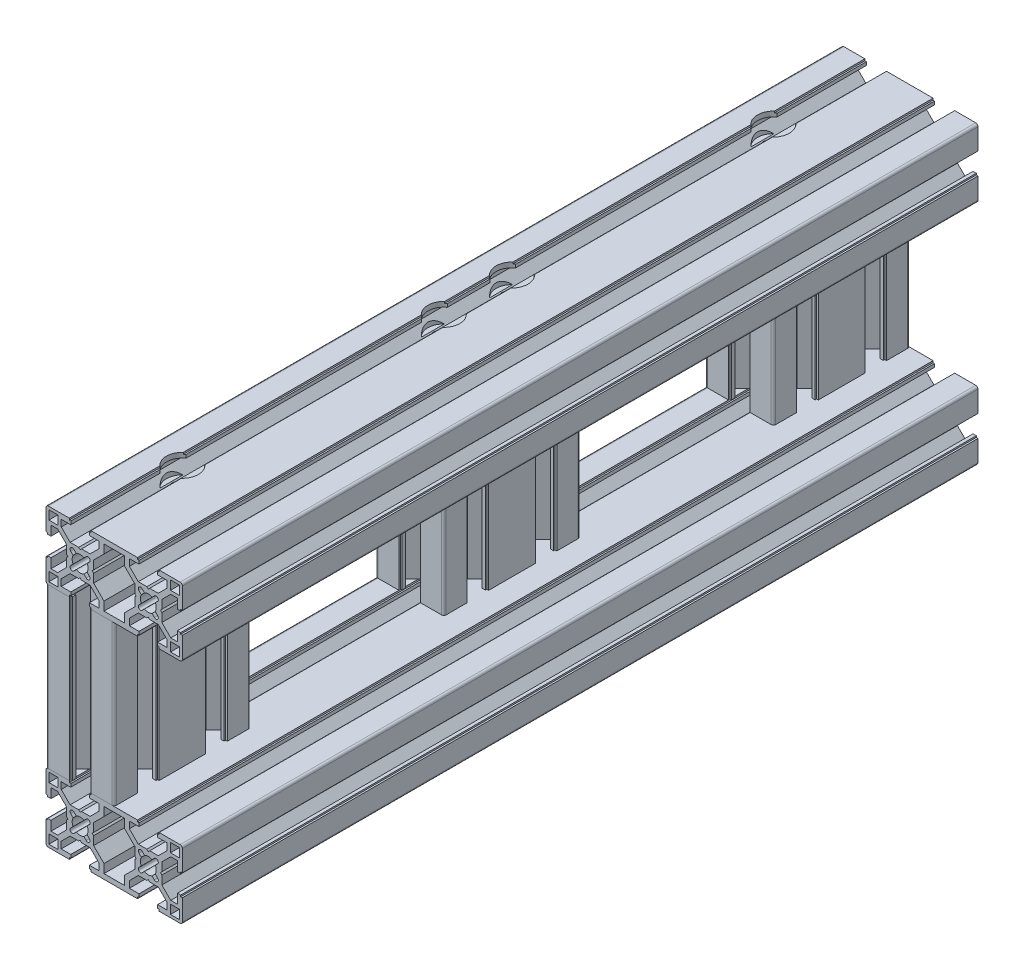
from build123d import *

# Parameters (mm, degrees)
T_SLOT_CNCCAT_3060_1_OUTLINE_W               = 3.960773678
T_SLOT_CNCCAT_3060_1_OUTLINE_H               = 3.960773678
T_SLOT_CNCCAT_3060_1_DEPTH                   = 350
T_SLOT_START                                 = -35
T_SLOT_CNCCAT_3060_1_2_OUTLINE_W             = 3.960773678
T_SLOT_CNCCAT_3060_1_2_OUTLINE_H             = 3.960773678
T_SLOT_CNCCAT_3060_1_2_DEPTH                 = 70
T_SLOT_CNCCAT_3060_1_3_OUTLINE_W             = 3.960773678
T_SLOT_CNCCAT_3060_1_3_OUTLINE_H             = 3.960773678
T_SLOT_CNCCAT_3060_1_3_DEPTH                 = 70
T_SLOT_CNCCAT_3060_1_4_OUTLINE_W             = 3.960773678
T_SLOT_CNCCAT_3060_1_4_OUTLINE_H             = 3.960773678
T_SLOT_CNCCAT_3060_1_4_DEPTH                 = 70
T_SLOT_CNCCAT_3060_1_5_OUTLINE_W             = 3.960773678
T_SLOT_CNCCAT_3060_1_5_OUTLINE_H             = 3.960773678
T_SLOT_CNCCAT_3060_1_5_DEPTH                 = 350
CBORE_FOR_M8_HEX_SOCKET_HEAD_CAP_SCR_2_COUNT = 2
CBORE_FOR_M8_HEX_SOCKET_HEAD_CAP_SCR_2_PITCH = 115
CBORE_FOR_M8_HEX_SOCKET_HEAD_CAP_SCR_3_COUNT = 2
CBORE_FOR_M8_HEX_SOCKET_HEAD_CAP_SCR_3_PITCH = 145
CBORE_FOR_M8_HEX_SOCKET_HEAD_CAP_SCR_4_COUNT = 2
CBORE_FOR_M8_HEX_SOCKET_HEAD_CAP_SCR_4_PITCH = 260
CBORE_FOR_M8_HEX_SOCKET_HEAD_CAP_SCR_5_COUNT = 2
CBORE_FOR_M8_HEX_SOCKET_HEAD_CAP_SCR_5_PITCH = 115
CBORE_FOR_M8_HEX_SOCKET_HEAD_CAP_SCR_6_COUNT = 2
CBORE_FOR_M8_HEX_SOCKET_HEAD_CAP_SCR_6_PITCH = 145
CBORE_FOR_M8_HEX_SOCKET_HEAD_CAP_SCR_7_COUNT = 2
CBORE_FOR_M8_HEX_SOCKET_HEAD_CAP_SCR_7_PITCH = 260


with BuildPart() as part:
    # T-slot CNCCAT-3060(1): read off the stored shape, not the designer's step
    # T-slot CNCCAT-3060(1) outline → T-slot CNCCAT-3060(1) (new body)
    with BuildSketch(Plane.XY):
        with BuildLine():
            Line((-20.956716316, -49.380405557), (-20.337121873, -50))
            Line((-20.337121873, -50), (-20.956716316, -50.619594443))
            Line((-20.956716316, -50.619594443), (-20.956716316, -54.401081398))
            Line((-20.956716316, -54.401081398), (-24.863654578, -58.30801966))
            Line((-24.863654578, -58.30801966), (-27.8, -58.30801966))
            Line((-27.8, -58.30801966), (-27.8, -54.1))
            Line((-27.8, -54.1), (-29.233870922, -54.1))
            Line((-29.233870922, -54.1), (-29.233870922, -54.756280561))
            Line((-29.233870922, -54.756280561), (-30, -54.756280561))
            Line((-30, -54.756280561), (-30, -64))
            ThreePointArc((-30, -64), (-29.707106781, -64.707106781), (-29, -65))
            Line((-29, -65), (-19.756280561, -65))
            Line((-19.756280561, -65), (-19.756280561, -64.233870922))
            Line((-19.756280561, -64.233870922), (-19.1, -64.233870922))
            Line((-19.1, -64.233870922), (-19.1, -62.8))
            Line((-19.1, -62.8), (-23.30801966, -62.8))
            Line((-23.30801966, -62.8), (-23.30801966, -59.863654578))
            Line((-23.30801966, -59.863654578), (-19.401081398, -55.956716316))
            Line((-19.401081398, -55.956716316), (-15.619594443, -55.956716316))
            Line((-15.619594443, -55.956716316), (-15, -55.337121873))
            Line((-15, -55.337121873), (-14.380405557, -55.956716316))
            Line((-14.380405557, -55.956716316), (-10.598918602, -55.956716316))
            Line((-10.598918602, -55.956716316), (-6.69198034, -59.863654578))
            Line((-6.69198034, -59.863654578), (-6.69198034, -62.8))
            Line((-6.69198034, -62.8), (-10.9, -62.8))
            Line((-10.9, -62.8), (-10.9, -64.233870922))
            Line((-10.9, -64.233870922), (-10.243719439, -64.233870922))
            Line((-10.243719439, -64.233870922), (-10.243719439, -65))
            Line((-10.243719439, -65), (10.243719439, -65))
            Line((10.243719439, -65), (10.243719439, -64.233870922))
            Line((10.243719439, -64.233870922), (10.9, -64.233870922))
            Line((10.9, -64.233870922), (10.9, -62.8))
            Line((10.9, -62.8), (6.69198034, -62.8))
            Line((6.69198034, -62.8), (6.69198034, -59.863654578))
            Line((6.69198034, -59.863654578), (10.598918602, -55.956716316))
            Line((10.598918602, -55.956716316), (14.380405557, -55.956716316))
            Line((14.380405557, -55.956716316), (15, -55.337121873))
            Line((15, -55.337121873), (15.619594443, -55.956716316))
            Line((15.619594443, -55.956716316), (19.401081398, -55.956716316))
            Line((19.401081398, -55.956716316), (23.30801966, -59.863654578))
            Line((23.30801966, -59.863654578), (23.30801966, -62.8))
            Line((23.30801966, -62.8), (19.1, -62.8))
            Line((19.1, -62.8), (19.1, -64.233870922))
            Line((19.1, -64.233870922), (19.756280561, -64.233870922))
            Line((19.756280561, -64.233870922), (19.756280561, -65))
            Line((19.756280561, -65), (29, -65))
            ThreePointArc((29, -65), (29.707106781, -64.707106781), (30, -64))
            Line((30, -64), (30, -54.756280561))
            Line((30, -54.756280561), (29.233870922, -54.756280561))
            Line((29.233870922, -54.756280561), (29.233870922, -54.1))
            Line((29.233870922, -54.1), (27.8, -54.1))
            Line((27.8, -54.1), (27.8, -58.30801966))
            Line((27.8, -58.30801966), (24.863654578, -58.30801966))
            Line((24.863654578, -58.30801966), (20.956716316, -54.401081398))
            Line((20.956716316, -54.401081398), (20.956716316, -50.619594443))
            Line((20.956716316, -50.619594443), (20.337121873, -50))
            Line((20.337121873, -50), (20.956716316, -49.380405557))
            Line((20.956716316, -49.380405557), (20.956716316, -45.598918602))
            Line((20.956716316, -45.598918602), (24.863654578, -41.69198034))
            Line((24.863654578, -41.69198034), (27.8, -41.69198034))
            Line((27.8, -41.69198034), (27.8, -45.9))
            Line((27.8, -45.9), (29.233870922, -45.9))
            Line((29.233870922, -45.9), (29.233870922, -45.243719439))
            Line((29.233870922, -45.243719439), (30, -45.243719439))
            Line((30, -45.243719439), (30, -36))
            ThreePointArc((30, -36), (29.707106781, -35.292893219), (29, -35))
            Line((29, -35), (19.756280561, -35))
            Line((19.756280561, -35), (19.756280561, -35.766129078))
            Line((19.756280561, -35.766129078), (19.1, -35.766129078))
            Line((19.1, -35.766129078), (19.1, -37.2))
            Line((19.1, -37.2), (23.30801966, -37.2))
            Line((23.30801966, -37.2), (23.30801966, -40.136345422))
            Line((23.30801966, -40.136345422), (19.401081398, -44.043283684))
            Line((19.401081398, -44.043283684), (15.619594443, -44.043283684))
            Line((15.619594443, -44.043283684), (15, -44.662878127))
            Line((15, -44.662878127), (14.380405557, -44.043283684))
            Line((14.380405557, -44.043283684), (10.598918602, -44.043283684))
            Line((10.598918602, -44.043283684), (6.69198034, -40.136345422))
            Line((6.69198034, -40.136345422), (6.69198034, -37.2))
            Line((6.69198034, -37.2), (10.9, -37.2))
            Line((10.9, -37.2), (10.9, -35.766129078))
            Line((10.9, -35.766129078), (10.243719439, -35.766129078))
            Line((10.243719439, -35.766129078), (10.243719439, -35))
            Line((10.243719439, -35), (-10.243719439, -35))
            Line((-10.243719439, -35), (-10.243719439, -35.766129078))
            Line((-10.243719439, -35.766129078), (-10.9, -35.766129078))
            Line((-10.9, -35.766129078), (-10.9, -37.2))
            Line((-10.9, -37.2), (-6.69198034, -37.2))
            Line((-6.69198034, -37.2), (-6.69198034, -40.136345422))
            Line((-6.69198034, -40.136345422), (-10.598918602, -44.043283684))
            Line((-10.598918602, -44.043283684), (-14.380405557, -44.043283684))
            Line((-14.380405557, -44.043283684), (-15, -44.662878127))
            Line((-15, -44.662878127), (-15.619594443, -44.043283684))
            Line((-15.619594443, -44.043283684), (-19.401081398, -44.043283684))
            Line((-19.401081398, -44.043283684), (-23.30801966, -40.136345422))
            Line((-23.30801966, -40.136345422), (-23.30801966, -37.2))
            Line((-23.30801966, -37.2), (-19.1, -37.2))
            Line((-19.1, -37.2), (-19.1, -35.766129078))
            Line((-19.1, -35.766129078), (-19.756280561, -35.766129078))
            Line((-19.756280561, -35.766129078), (-19.756280561, -35))
            Line((-19.756280561, -35), (-29, -35))
            ThreePointArc((-29, -35), (-29.707106781, -35.292893219), (-30, -36))
            Line((-30, -36), (-30, -45.243719439))
            Line((-30, -45.243719439), (-29.233870922, -45.243719439))
            Line((-29.233870922, -45.243719439), (-29.233870922, -45.9))
            Line((-29.233870922, -45.9), (-27.8, -45.9))
            Line((-27.8, -45.9), (-27.8, -41.69198034))
            Line((-27.8, -41.69198034), (-24.863654578, -41.69198034))
            Line((-24.863654578, -41.69198034), (-20.956716316, -45.598918602))
            Line((-20.956716316, -45.598918602), (-20.956716316, -49.380405557))
        make_face()
        with Locations((-26.75, -61.75)):
            Rectangle(T_SLOT_CNCCAT_3060_1_OUTLINE_W, T_SLOT_CNCCAT_3060_1_OUTLINE_H, mode=Mode.SUBTRACT)
        with Locations((26.75, -61.75)):
            Rectangle(T_SLOT_CNCCAT_3060_1_OUTLINE_W, T_SLOT_CNCCAT_3060_1_OUTLINE_H, mode=Mode.SUBTRACT)
        with BuildLine():
            Line((-19.109450474, -52.695236912), (-18.078815026, -51.664601464))
            ThreePointArc((-18.078815026, -51.664601464), (-18.5, -50), (-18.078815026, -48.335398536))
            Line((-18.078815026, -48.335398536), (-19.109450474, -47.304763088))
            ThreePointArc((-19.109450474, -47.304763088), (-19.109450474, -45.890549526), (-17.695236912, -45.890549526))
            Line((-17.695236912, -45.890549526), (-16.664601464, -46.921184974))
            ThreePointArc((-16.664601464, -46.921184974), (-15, -46.5), (-13.335398536, -46.921184974))
            Line((-13.335398536, -46.921184974), (-12.304763088, -45.890549526))
            ThreePointArc((-12.304763088, -45.890549526), (-10.890549526, -45.890549526), (-10.890549526, -47.304763088))
            Line((-10.890549526, -47.304763088), (-11.921184974, -48.335398536))
            ThreePointArc((-11.921184974, -48.335398536), (-11.5, -50), (-11.921184974, -51.664601464))
            Line((-11.921184974, -51.664601464), (-10.890549526, -52.695236912))
            ThreePointArc((-10.890549526, -52.695236912), (-10.890549526, -54.109450474), (-12.304763088, -54.109450474))
            Line((-12.304763088, -54.109450474), (-13.335398536, -53.078815026))
            ThreePointArc((-13.335398536, -53.078815026), (-15, -53.5), (-16.664601464, -53.078815026))
            Line((-16.664601464, -53.078815026), (-17.695236912, -54.109450474))
            ThreePointArc((-17.695236912, -54.109450474), (-19.109450474, -54.109450474), (-19.109450474, -52.695236912))
        make_face(mode=Mode.SUBTRACT)
        Polygon((9.043283684, -54.401081398), (4.49198034, -58.952384741), (4.49198034, -62.8), (-4.49198034, -62.8), (-4.49198034, -58.952384741), (-9.043283684, -54.401081398), (-9.043283684, -50.619594443), (-9.662878127, -50), (-9.043283684, -49.380405557), (-9.043283684, -45.598918602), (-4.49198034, -41.047615259), (-4.49198034, -37.2), (4.49198034, -37.2), (4.49198034, -41.047615259), (9.043283684, -45.598918602), (9.043283684, -49.380405557), (9.662878127, -50), (9.043283684, -50.619594443), align=None, mode=Mode.SUBTRACT)
        with Locations((-26.75, -38.25)):
            Rectangle(T_SLOT_CNCCAT_3060_1_OUTLINE_W, T_SLOT_CNCCAT_3060_1_OUTLINE_H, mode=Mode.SUBTRACT)
        with BuildLine():
            Line((19.109450474, -47.304763088), (18.078815026, -48.335398536))
            ThreePointArc((18.078815026, -48.335398536), (18.5, -50), (18.078815026, -51.664601464))
            Line((18.078815026, -51.664601464), (19.109450474, -52.695236912))
            ThreePointArc((19.109450474, -52.695236912), (19.109450474, -54.109450474), (17.695236912, -54.109450474))
            Line((17.695236912, -54.109450474), (16.664601464, -53.078815026))
            ThreePointArc((16.664601464, -53.078815026), (15, -53.5), (13.335398536, -53.078815026))
            Line((13.335398536, -53.078815026), (12.304763088, -54.109450474))
            ThreePointArc((12.304763088, -54.109450474), (10.890549526, -54.109450474), (10.890549526, -52.695236912))
            Line((10.890549526, -52.695236912), (11.921184974, -51.664601464))
            ThreePointArc((11.921184974, -51.664601464), (11.5, -50), (11.921184974, -48.335398536))
            Line((11.921184974, -48.335398536), (10.890549526, -47.304763088))
            ThreePointArc((10.890549526, -47.304763088), (10.890549526, -45.890549526), (12.304763088, -45.890549526))
            Line((12.304763088, -45.890549526), (13.335398536, -46.921184974))
            ThreePointArc((13.335398536, -46.921184974), (15, -46.5), (16.664601464, -46.921184974))
            Line((16.664601464, -46.921184974), (17.695236912, -45.890549526))
            ThreePointArc((17.695236912, -45.890549526), (19.109450474, -45.890549526), (19.109450474, -47.304763088))
        make_face(mode=Mode.SUBTRACT)
        with Locations((26.75, -38.25)):
            Rectangle(T_SLOT_CNCCAT_3060_1_OUTLINE_W, T_SLOT_CNCCAT_3060_1_OUTLINE_H, mode=Mode.SUBTRACT)
    extrude(amount=T_SLOT_CNCCAT_3060_1_DEPTH)

    # Sketch28 → CBORE for M8 Hex Socket Head Cap Screw2 (revolve, cut)
    with BuildSketch(Plane(origin=(-15, -65, 45), x_dir=(0, 0, -1), z_dir=(1, 0, 0))):
        Polygon((0, 0), (0, 30), (4.5, 30), (4.5, 8.6), (7, 8.6), (7, 0), align=None)
    cbore_for_m8_hex_socket_head_cap_screw2 = revolve(axis=Axis((-15, -71.35, 45), (0, 1, 0)), mode=Mode.SUBTRACT)

    # CBORE for M8 Hex Socket Head Cap Scr 5: CBORE for M8 Hex Socket Head Cap Screw2 ×2
    with Locations(*[(0, 0, i * CBORE_FOR_M8_HEX_SOCKET_HEAD_CAP_SCR_5_PITCH) for i in range(1, CBORE_FOR_M8_HEX_SOCKET_HEAD_CAP_SCR_5_COUNT)]):
        add(cbore_for_m8_hex_socket_head_cap_screw2, mode=Mode.SUBTRACT)

    # CBORE for M8 Hex Socket Head Cap Scr 6: CBORE for M8 Hex Socket Head Cap Screw2 ×2
    with Locations(*[(0, 0, i * CBORE_FOR_M8_HEX_SOCKET_HEAD_CAP_SCR_6_PITCH) for i in range(1, CBORE_FOR_M8_HEX_SOCKET_HEAD_CAP_SCR_6_COUNT)]):
        add(cbore_for_m8_hex_socket_head_cap_screw2, mode=Mode.SUBTRACT)

    # CBORE for M8 Hex Socket Head Cap Scr 7: CBORE for M8 Hex Socket Head Cap Screw2 ×2
    with Locations(*[(0, 0, i * CBORE_FOR_M8_HEX_SOCKET_HEAD_CAP_SCR_7_PITCH) for i in range(1, CBORE_FOR_M8_HEX_SOCKET_HEAD_CAP_SCR_7_COUNT)]):
        add(cbore_for_m8_hex_socket_head_cap_screw2, mode=Mode.SUBTRACT)


with BuildPart() as body_2:
    # T-slot CNCCAT-3060_1 2 outline → T-slot CNCCAT-3060_1 2 (new body)
    with BuildSketch(Plane(origin=(0, 0, 0), x_dir=(1, 0, 0), z_dir=(0, 1, 0)).offset(T_SLOT_START)):
        with BuildLine():
            Line((-15, -9.662878127), (-15.619594443, -9.043283684))
            Line((-15.619594443, -9.043283684), (-19.401081398, -9.043283684))
            Line((-19.401081398, -9.043283684), (-23.30801966, -5.136345422))
            Line((-23.30801966, -5.136345422), (-23.30801966, -2.2))
            Line((-23.30801966, -2.2), (-19.1, -2.2))
            Line((-19.1, -2.2), (-19.1, -0.766129078))
            Line((-19.1, -0.766129078), (-19.756280561, -0.766129078))
            Line((-19.756280561, -0.766129078), (-19.756280561, 0))
            Line((-19.756280561, 0), (-29, 0))
            ThreePointArc((-29, 0), (-29.707106781, -0.292893219), (-30, -1))
            Line((-30, -1), (-30, -10.243719439))
            Line((-30, -10.243719439), (-29.233870922, -10.243719439))
            Line((-29.233870922, -10.243719439), (-29.233870922, -10.9))
            Line((-29.233870922, -10.9), (-27.8, -10.9))
            Line((-27.8, -10.9), (-27.8, -6.69198034))
            Line((-27.8, -6.69198034), (-24.863654578, -6.69198034))
            Line((-24.863654578, -6.69198034), (-20.956716316, -10.598918602))
            Line((-20.956716316, -10.598918602), (-20.956716316, -14.380405557))
            Line((-20.956716316, -14.380405557), (-20.337121873, -15))
            Line((-20.337121873, -15), (-20.956716316, -15.619594443))
            Line((-20.956716316, -15.619594443), (-20.956716316, -19.401081398))
            Line((-20.956716316, -19.401081398), (-24.863654578, -23.30801966))
            Line((-24.863654578, -23.30801966), (-27.8, -23.30801966))
            Line((-27.8, -23.30801966), (-27.8, -19.1))
            Line((-27.8, -19.1), (-29.233870922, -19.1))
            Line((-29.233870922, -19.1), (-29.233870922, -19.756280561))
            Line((-29.233870922, -19.756280561), (-30, -19.756280561))
            Line((-30, -19.756280561), (-30, -40.243719439))
            Line((-30, -40.243719439), (-29.233870922, -40.243719439))
            Line((-29.233870922, -40.243719439), (-29.233870922, -40.9))
            Line((-29.233870922, -40.9), (-27.8, -40.9))
            Line((-27.8, -40.9), (-27.8, -36.69198034))
            Line((-27.8, -36.69198034), (-24.863654578, -36.69198034))
            Line((-24.863654578, -36.69198034), (-20.956716316, -40.598918602))
            Line((-20.956716316, -40.598918602), (-20.956716316, -44.380405557))
            Line((-20.956716316, -44.380405557), (-20.337121873, -45))
            Line((-20.337121873, -45), (-20.956716316, -45.619594443))
            Line((-20.956716316, -45.619594443), (-20.956716316, -49.401081398))
            Line((-20.956716316, -49.401081398), (-24.863654578, -53.30801966))
            Line((-24.863654578, -53.30801966), (-27.8, -53.30801966))
            Line((-27.8, -53.30801966), (-27.8, -49.1))
            Line((-27.8, -49.1), (-29.233870922, -49.1))
            Line((-29.233870922, -49.1), (-29.233870922, -49.756280561))
            Line((-29.233870922, -49.756280561), (-30, -49.756280561))
            Line((-30, -49.756280561), (-30, -59))
            ThreePointArc((-30, -59), (-29.707106781, -59.707106781), (-29, -60))
            Line((-29, -60), (-19.756280561, -60))
            Line((-19.756280561, -60), (-19.756280561, -59.233870922))
            Line((-19.756280561, -59.233870922), (-19.1, -59.233870922))
            Line((-19.1, -59.233870922), (-19.1, -57.8))
            Line((-19.1, -57.8), (-23.30801966, -57.8))
            Line((-23.30801966, -57.8), (-23.30801966, -54.863654578))
            Line((-23.30801966, -54.863654578), (-19.401081398, -50.956716316))
            Line((-19.401081398, -50.956716316), (-15.619594443, -50.956716316))
            Line((-15.619594443, -50.956716316), (-15, -50.337121873))
            Line((-15, -50.337121873), (-14.380405557, -50.956716316))
            Line((-14.380405557, -50.956716316), (-10.598918602, -50.956716316))
            Line((-10.598918602, -50.956716316), (-6.69198034, -54.863654578))
            Line((-6.69198034, -54.863654578), (-6.69198034, -57.8))
            Line((-6.69198034, -57.8), (-10.9, -57.8))
            Line((-10.9, -57.8), (-10.9, -59.233870922))
            Line((-10.9, -59.233870922), (-10.243719439, -59.233870922))
            Line((-10.243719439, -59.233870922), (-10.243719439, -60))
            Line((-10.243719439, -60), (-1, -60))
            ThreePointArc((-1, -60), (-0.292893219, -59.707106781), (0, -59))
            Line((0, -59), (0, -49.756280561))
            Line((0, -49.756280561), (-0.766129078, -49.756280561))
            Line((-0.766129078, -49.756280561), (-0.766129078, -49.1))
            Line((-0.766129078, -49.1), (-2.2, -49.1))
            Line((-2.2, -49.1), (-2.2, -53.30801966))
            Line((-2.2, -53.30801966), (-5.136345422, -53.30801966))
            Line((-5.136345422, -53.30801966), (-9.043283684, -49.401081398))
            Line((-9.043283684, -49.401081398), (-9.043283684, -45.619594443))
            Line((-9.043283684, -45.619594443), (-9.662878127, -45))
            Line((-9.662878127, -45), (-9.043283684, -44.380405557))
            Line((-9.043283684, -44.380405557), (-9.043283684, -40.598918602))
            Line((-9.043283684, -40.598918602), (-5.136345422, -36.69198034))
            Line((-5.136345422, -36.69198034), (-2.2, -36.69198034))
            Line((-2.2, -36.69198034), (-2.2, -40.9))
            Line((-2.2, -40.9), (-0.766129078, -40.9))
            Line((-0.766129078, -40.9), (-0.766129078, -40.243719439))
            Line((-0.766129078, -40.243719439), (0, -40.243719439))
            Line((0, -40.243719439), (0, -19.756280561))
            Line((0, -19.756280561), (-0.766129078, -19.756280561))
            Line((-0.766129078, -19.756280561), (-0.766129078, -19.1))
            Line((-0.766129078, -19.1), (-2.2, -19.1))
            Line((-2.2, -19.1), (-2.2, -23.30801966))
            Line((-2.2, -23.30801966), (-5.136345422, -23.30801966))
            Line((-5.136345422, -23.30801966), (-9.043283684, -19.401081398))
            Line((-9.043283684, -19.401081398), (-9.043283684, -15.619594443))
            Line((-9.043283684, -15.619594443), (-9.662878127, -15))
            Line((-9.662878127, -15), (-9.043283684, -14.380405557))
            Line((-9.043283684, -14.380405557), (-9.043283684, -10.598918602))
            Line((-9.043283684, -10.598918602), (-5.136345422, -6.69198034))
            Line((-5.136345422, -6.69198034), (-2.2, -6.69198034))
            Line((-2.2, -6.69198034), (-2.2, -10.9))
            Line((-2.2, -10.9), (-0.766129078, -10.9))
            Line((-0.766129078, -10.9), (-0.766129078, -10.243719439))
            Line((-0.766129078, -10.243719439), (0, -10.243719439))
            Line((0, -10.243719439), (0, -1))
            ThreePointArc((0, -1), (-0.292893219, -0.292893219), (-1, 0))
            Line((-1, 0), (-10.243719439, 0))
            Line((-10.243719439, 0), (-10.243719439, -0.766129078))
            Line((-10.243719439, -0.766129078), (-10.9, -0.766129078))
            Line((-10.9, -0.766129078), (-10.9, -2.2))
            Line((-10.9, -2.2), (-6.69198034, -2.2))
            Line((-6.69198034, -2.2), (-6.69198034, -5.136345422))
            Line((-6.69198034, -5.136345422), (-10.598918602, -9.043283684))
            Line((-10.598918602, -9.043283684), (-14.380405557, -9.043283684))
            Line((-14.380405557, -9.043283684), (-15, -9.662878127))
        make_face()
        with Locations((-26.75, -56.75)):
            Rectangle(T_SLOT_CNCCAT_3060_1_2_OUTLINE_W, T_SLOT_CNCCAT_3060_1_2_OUTLINE_H, mode=Mode.SUBTRACT)
        with Locations((-3.25, -56.75)):
            Rectangle(T_SLOT_CNCCAT_3060_1_2_OUTLINE_W, T_SLOT_CNCCAT_3060_1_2_OUTLINE_H, mode=Mode.SUBTRACT)
        with BuildLine():
            ThreePointArc((-13.335398536, -48.078815026), (-15, -48.5), (-16.664601464, -48.078815026))
            Line((-16.664601464, -48.078815026), (-17.695236912, -49.109450474))
            ThreePointArc((-17.695236912, -49.109450474), (-19.109450474, -49.109450474), (-19.109450474, -47.695236912))
            Line((-19.109450474, -47.695236912), (-18.078815026, -46.664601464))
            ThreePointArc((-18.078815026, -46.664601464), (-18.5, -45), (-18.078815026, -43.335398536))
            Line((-18.078815026, -43.335398536), (-19.109450474, -42.304763088))
            ThreePointArc((-19.109450474, -42.304763088), (-19.109450474, -40.890549526), (-17.695236912, -40.890549526))
            Line((-17.695236912, -40.890549526), (-16.664601464, -41.921184974))
            ThreePointArc((-16.664601464, -41.921184974), (-15, -41.5), (-13.335398536, -41.921184974))
            Line((-13.335398536, -41.921184974), (-12.304763088, -40.890549526))
            ThreePointArc((-12.304763088, -40.890549526), (-10.890549526, -40.890549526), (-10.890549526, -42.304763088))
            Line((-10.890549526, -42.304763088), (-11.921184974, -43.335398536))
            ThreePointArc((-11.921184974, -43.335398536), (-11.5, -45), (-11.921184974, -46.664601464))
            Line((-11.921184974, -46.664601464), (-10.890549526, -47.695236912))
            ThreePointArc((-10.890549526, -47.695236912), (-10.890549526, -49.109450474), (-12.304763088, -49.109450474))
            Line((-12.304763088, -49.109450474), (-13.335398536, -48.078815026))
        make_face(mode=Mode.SUBTRACT)
        with Locations((-26.75, -3.25)):
            Rectangle(T_SLOT_CNCCAT_3060_1_2_OUTLINE_W, T_SLOT_CNCCAT_3060_1_2_OUTLINE_H, mode=Mode.SUBTRACT)
        Polygon((-2.2, -25.50801966), (-2.2, -34.49198034), (-6.047615259, -34.49198034), (-10.598918602, -39.043283684), (-14.380405557, -39.043283684), (-15, -39.662878127), (-15.619594443, -39.043283684), (-19.401081398, -39.043283684), (-23.952384741, -34.49198034), (-27.8, -34.49198034), (-27.8, -25.50801966), (-23.952384741, -25.50801966), (-19.401081398, -20.956716316), (-15.619594443, -20.956716316), (-15, -20.337121873), (-14.380405557, -20.956716316), (-10.598918602, -20.956716316), (-6.047615259, -25.50801966), align=None, mode=Mode.SUBTRACT)
        with BuildLine():
            ThreePointArc((-16.664601464, -11.921184974), (-15, -11.5), (-13.335398536, -11.921184974))
            Line((-13.335398536, -11.921184974), (-12.304763088, -10.890549526))
            ThreePointArc((-12.304763088, -10.890549526), (-10.890549526, -10.890549526), (-10.890549526, -12.304763088))
            Line((-10.890549526, -12.304763088), (-11.921184974, -13.335398536))
            ThreePointArc((-11.921184974, -13.335398536), (-11.5, -15), (-11.921184974, -16.664601464))
            Line((-11.921184974, -16.664601464), (-10.890549526, -17.695236912))
            ThreePointArc((-10.890549526, -17.695236912), (-10.890549526, -19.109450474), (-12.304763088, -19.109450474))
            Line((-12.304763088, -19.109450474), (-13.335398536, -18.078815026))
            ThreePointArc((-13.335398536, -18.078815026), (-15, -18.5), (-16.664601464, -18.078815026))
            Line((-16.664601464, -18.078815026), (-17.695236912, -19.109450474))
            ThreePointArc((-17.695236912, -19.109450474), (-19.109450474, -19.109450474), (-19.109450474, -17.695236912))
            Line((-19.109450474, -17.695236912), (-18.078815026, -16.664601464))
            ThreePointArc((-18.078815026, -16.664601464), (-18.5, -15), (-18.078815026, -13.335398536))
            Line((-18.078815026, -13.335398536), (-19.109450474, -12.304763088))
            ThreePointArc((-19.109450474, -12.304763088), (-19.109450474, -10.890549526), (-17.695236912, -10.890549526))
            Line((-17.695236912, -10.890549526), (-16.664601464, -11.921184974))
        make_face(mode=Mode.SUBTRACT)
        with Locations((-3.25, -3.25)):
            Rectangle(T_SLOT_CNCCAT_3060_1_2_OUTLINE_W, T_SLOT_CNCCAT_3060_1_2_OUTLINE_H, mode=Mode.SUBTRACT)
    extrude(amount=T_SLOT_CNCCAT_3060_1_2_DEPTH)


with BuildPart() as body_3:
    # T-slot CNCCAT-3060_1 3 outline → T-slot CNCCAT-3060_1 3 (new body)
    with BuildSketch(Plane(origin=(0, 0, 0), x_dir=(1, 0, 0), z_dir=(0, 1, 0)).offset(T_SLOT_START)):
        with BuildLine():
            Line((-15, -154.662878127), (-15.619594443, -154.043283684))
            Line((-15.619594443, -154.043283684), (-19.401081398, -154.043283684))
            Line((-19.401081398, -154.043283684), (-23.30801966, -150.136345422))
            Line((-23.30801966, -150.136345422), (-23.30801966, -147.2))
            Line((-23.30801966, -147.2), (-19.1, -147.2))
            Line((-19.1, -147.2), (-19.1, -145.766129078))
            Line((-19.1, -145.766129078), (-19.756280561, -145.766129078))
            Line((-19.756280561, -145.766129078), (-19.756280561, -145))
            Line((-19.756280561, -145), (-29, -145))
            ThreePointArc((-29, -145), (-29.707106781, -145.292893219), (-30, -146))
            Line((-30, -146), (-30, -155.243719439))
            Line((-30, -155.243719439), (-29.233870922, -155.243719439))
            Line((-29.233870922, -155.243719439), (-29.233870922, -155.9))
            Line((-29.233870922, -155.9), (-27.8, -155.9))
            Line((-27.8, -155.9), (-27.8, -151.69198034))
            Line((-27.8, -151.69198034), (-24.863654578, -151.69198034))
            Line((-24.863654578, -151.69198034), (-20.956716316, -155.598918602))
            Line((-20.956716316, -155.598918602), (-20.956716316, -159.380405557))
            Line((-20.956716316, -159.380405557), (-20.337121873, -160))
            Line((-20.337121873, -160), (-20.956716316, -160.619594443))
            Line((-20.956716316, -160.619594443), (-20.956716316, -164.401081398))
            Line((-20.956716316, -164.401081398), (-24.863654578, -168.30801966))
            Line((-24.863654578, -168.30801966), (-27.8, -168.30801966))
            Line((-27.8, -168.30801966), (-27.8, -164.1))
            Line((-27.8, -164.1), (-29.233870922, -164.1))
            Line((-29.233870922, -164.1), (-29.233870922, -164.756280561))
            Line((-29.233870922, -164.756280561), (-30, -164.756280561))
            Line((-30, -164.756280561), (-30, -185.243719439))
            Line((-30, -185.243719439), (-29.233870922, -185.243719439))
            Line((-29.233870922, -185.243719439), (-29.233870922, -185.9))
            Line((-29.233870922, -185.9), (-27.8, -185.9))
            Line((-27.8, -185.9), (-27.8, -181.69198034))
            Line((-27.8, -181.69198034), (-24.863654578, -181.69198034))
            Line((-24.863654578, -181.69198034), (-20.956716316, -185.598918602))
            Line((-20.956716316, -185.598918602), (-20.956716316, -189.380405557))
            Line((-20.956716316, -189.380405557), (-20.337121873, -190))
            Line((-20.337121873, -190), (-20.956716316, -190.619594443))
            Line((-20.956716316, -190.619594443), (-20.956716316, -194.401081398))
            Line((-20.956716316, -194.401081398), (-24.863654578, -198.30801966))
            Line((-24.863654578, -198.30801966), (-27.8, -198.30801966))
            Line((-27.8, -198.30801966), (-27.8, -194.1))
            Line((-27.8, -194.1), (-29.233870922, -194.1))
            Line((-29.233870922, -194.1), (-29.233870922, -194.756280561))
            Line((-29.233870922, -194.756280561), (-30, -194.756280561))
            Line((-30, -194.756280561), (-30, -204))
            ThreePointArc((-30, -204), (-29.707106781, -204.707106781), (-29, -205))
            Line((-29, -205), (-19.756280561, -205))
            Line((-19.756280561, -205), (-19.756280561, -204.233870922))
            Line((-19.756280561, -204.233870922), (-19.1, -204.233870922))
            Line((-19.1, -204.233870922), (-19.1, -202.8))
            Line((-19.1, -202.8), (-23.30801966, -202.8))
            Line((-23.30801966, -202.8), (-23.30801966, -199.863654578))
            Line((-23.30801966, -199.863654578), (-19.401081398, -195.956716316))
            Line((-19.401081398, -195.956716316), (-15.619594443, -195.956716316))
            Line((-15.619594443, -195.956716316), (-15, -195.337121873))
            Line((-15, -195.337121873), (-14.380405557, -195.956716316))
            Line((-14.380405557, -195.956716316), (-10.598918602, -195.956716316))
            Line((-10.598918602, -195.956716316), (-6.69198034, -199.863654578))
            Line((-6.69198034, -199.863654578), (-6.69198034, -202.8))
            Line((-6.69198034, -202.8), (-10.9, -202.8))
            Line((-10.9, -202.8), (-10.9, -204.233870922))
            Line((-10.9, -204.233870922), (-10.243719439, -204.233870922))
            Line((-10.243719439, -204.233870922), (-10.243719439, -205))
            Line((-10.243719439, -205), (-1, -205))
            ThreePointArc((-1, -205), (-0.292893219, -204.707106781), (0, -204))
            Line((0, -204), (0, -194.756280561))
            Line((0, -194.756280561), (-0.766129078, -194.756280561))
            Line((-0.766129078, -194.756280561), (-0.766129078, -194.1))
            Line((-0.766129078, -194.1), (-2.2, -194.1))
            Line((-2.2, -194.1), (-2.2, -198.30801966))
            Line((-2.2, -198.30801966), (-5.136345422, -198.30801966))
            Line((-5.136345422, -198.30801966), (-9.043283684, -194.401081398))
            Line((-9.043283684, -194.401081398), (-9.043283684, -190.619594443))
            Line((-9.043283684, -190.619594443), (-9.662878127, -190))
            Line((-9.662878127, -190), (-9.043283684, -189.380405557))
            Line((-9.043283684, -189.380405557), (-9.043283684, -185.598918602))
            Line((-9.043283684, -185.598918602), (-5.136345422, -181.69198034))
            Line((-5.136345422, -181.69198034), (-2.2, -181.69198034))
            Line((-2.2, -181.69198034), (-2.2, -185.9))
            Line((-2.2, -185.9), (-0.766129078, -185.9))
            Line((-0.766129078, -185.9), (-0.766129078, -185.243719439))
            Line((-0.766129078, -185.243719439), (0, -185.243719439))
            Line((0, -185.243719439), (0, -164.756280561))
            Line((0, -164.756280561), (-0.766129078, -164.756280561))
            Line((-0.766129078, -164.756280561), (-0.766129078, -164.1))
            Line((-0.766129078, -164.1), (-2.2, -164.1))
            Line((-2.2, -164.1), (-2.2, -168.30801966))
            Line((-2.2, -168.30801966), (-5.136345422, -168.30801966))
            Line((-5.136345422, -168.30801966), (-9.043283684, -164.401081398))
            Line((-9.043283684, -164.401081398), (-9.043283684, -160.619594443))
            Line((-9.043283684, -160.619594443), (-9.662878127, -160))
            Line((-9.662878127, -160), (-9.043283684, -159.380405557))
            Line((-9.043283684, -159.380405557), (-9.043283684, -155.598918602))
            Line((-9.043283684, -155.598918602), (-5.136345422, -151.69198034))
            Line((-5.136345422, -151.69198034), (-2.2, -151.69198034))
            Line((-2.2, -151.69198034), (-2.2, -155.9))
            Line((-2.2, -155.9), (-0.766129078, -155.9))
            Line((-0.766129078, -155.9), (-0.766129078, -155.243719439))
            Line((-0.766129078, -155.243719439), (0, -155.243719439))
            Line((0, -155.243719439), (0, -146))
            ThreePointArc((0, -146), (-0.292893219, -145.292893219), (-1, -145))
            Line((-1, -145), (-10.243719439, -145))
            Line((-10.243719439, -145), (-10.243719439, -145.766129078))
            Line((-10.243719439, -145.766129078), (-10.9, -145.766129078))
            Line((-10.9, -145.766129078), (-10.9, -147.2))
            Line((-10.9, -147.2), (-6.69198034, -147.2))
            Line((-6.69198034, -147.2), (-6.69198034, -150.136345422))
            Line((-6.69198034, -150.136345422), (-10.598918602, -154.043283684))
            Line((-10.598918602, -154.043283684), (-14.380405557, -154.043283684))
            Line((-14.380405557, -154.043283684), (-15, -154.662878127))
        make_face()
        with Locations((-26.75, -201.75)):
            Rectangle(T_SLOT_CNCCAT_3060_1_3_OUTLINE_W, T_SLOT_CNCCAT_3060_1_3_OUTLINE_H, mode=Mode.SUBTRACT)
        with Locations((-3.25, -201.75)):
            Rectangle(T_SLOT_CNCCAT_3060_1_3_OUTLINE_W, T_SLOT_CNCCAT_3060_1_3_OUTLINE_H, mode=Mode.SUBTRACT)
        with BuildLine():
            ThreePointArc((-13.335398536, -193.078815026), (-15, -193.5), (-16.664601464, -193.078815026))
            Line((-16.664601464, -193.078815026), (-17.695236912, -194.109450474))
            ThreePointArc((-17.695236912, -194.109450474), (-19.109450474, -194.109450474), (-19.109450474, -192.695236912))
            Line((-19.109450474, -192.695236912), (-18.078815026, -191.664601464))
            ThreePointArc((-18.078815026, -191.664601464), (-18.5, -190), (-18.078815026, -188.335398536))
            Line((-18.078815026, -188.335398536), (-19.109450474, -187.304763088))
            ThreePointArc((-19.109450474, -187.304763088), (-19.109450474, -185.890549526), (-17.695236912, -185.890549526))
            Line((-17.695236912, -185.890549526), (-16.664601464, -186.921184974))
            ThreePointArc((-16.664601464, -186.921184974), (-15, -186.5), (-13.335398536, -186.921184974))
            Line((-13.335398536, -186.921184974), (-12.304763088, -185.890549526))
            ThreePointArc((-12.304763088, -185.890549526), (-10.890549526, -185.890549526), (-10.890549526, -187.304763088))
            Line((-10.890549526, -187.304763088), (-11.921184974, -188.335398536))
            ThreePointArc((-11.921184974, -188.335398536), (-11.5, -190), (-11.921184974, -191.664601464))
            Line((-11.921184974, -191.664601464), (-10.890549526, -192.695236912))
            ThreePointArc((-10.890549526, -192.695236912), (-10.890549526, -194.109450474), (-12.304763088, -194.109450474))
            Line((-12.304763088, -194.109450474), (-13.335398536, -193.078815026))
        make_face(mode=Mode.SUBTRACT)
        with Locations((-26.75, -148.25)):
            Rectangle(T_SLOT_CNCCAT_3060_1_3_OUTLINE_W, T_SLOT_CNCCAT_3060_1_3_OUTLINE_H, mode=Mode.SUBTRACT)
        Polygon((-2.2, -170.50801966), (-2.2, -179.49198034), (-6.047615259, -179.49198034), (-10.598918602, -184.043283684), (-14.380405557, -184.043283684), (-15, -184.662878127), (-15.619594443, -184.043283684), (-19.401081398, -184.043283684), (-23.952384741, -179.49198034), (-27.8, -179.49198034), (-27.8, -170.50801966), (-23.952384741, -170.50801966), (-19.401081398, -165.956716316), (-15.619594443, -165.956716316), (-15, -165.337121873), (-14.380405557, -165.956716316), (-10.598918602, -165.956716316), (-6.047615259, -170.50801966), align=None, mode=Mode.SUBTRACT)
        with BuildLine():
            ThreePointArc((-16.664601464, -156.921184974), (-15, -156.5), (-13.335398536, -156.921184974))
            Line((-13.335398536, -156.921184974), (-12.304763088, -155.890549526))
            ThreePointArc((-12.304763088, -155.890549526), (-10.890549526, -155.890549526), (-10.890549526, -157.304763088))
            Line((-10.890549526, -157.304763088), (-11.921184974, -158.335398536))
            ThreePointArc((-11.921184974, -158.335398536), (-11.5, -160), (-11.921184974, -161.664601464))
            Line((-11.921184974, -161.664601464), (-10.890549526, -162.695236912))
            ThreePointArc((-10.890549526, -162.695236912), (-10.890549526, -164.109450474), (-12.304763088, -164.109450474))
            Line((-12.304763088, -164.109450474), (-13.335398536, -163.078815026))
            ThreePointArc((-13.335398536, -163.078815026), (-15, -163.5), (-16.664601464, -163.078815026))
            Line((-16.664601464, -163.078815026), (-17.695236912, -164.109450474))
            ThreePointArc((-17.695236912, -164.109450474), (-19.109450474, -164.109450474), (-19.109450474, -162.695236912))
            Line((-19.109450474, -162.695236912), (-18.078815026, -161.664601464))
            ThreePointArc((-18.078815026, -161.664601464), (-18.5, -160), (-18.078815026, -158.335398536))
            Line((-18.078815026, -158.335398536), (-19.109450474, -157.304763088))
            ThreePointArc((-19.109450474, -157.304763088), (-19.109450474, -155.890549526), (-17.695236912, -155.890549526))
            Line((-17.695236912, -155.890549526), (-16.664601464, -156.921184974))
        make_face(mode=Mode.SUBTRACT)
        with Locations((-3.25, -148.25)):
            Rectangle(T_SLOT_CNCCAT_3060_1_3_OUTLINE_W, T_SLOT_CNCCAT_3060_1_3_OUTLINE_H, mode=Mode.SUBTRACT)
    extrude(amount=T_SLOT_CNCCAT_3060_1_3_DEPTH)


with BuildPart() as body_4:
    # T-slot CNCCAT-3060_1 4 outline → T-slot CNCCAT-3060_1 4 (new body)
    with BuildSketch(Plane(origin=(0, 0, 0), x_dir=(1, 0, 0), z_dir=(0, 1, 0)).offset(T_SLOT_START)):
        with BuildLine():
            Line((-15.619594443, -340.956716316), (-15, -340.337121873))
            Line((-15, -340.337121873), (-14.380405557, -340.956716316))
            Line((-14.380405557, -340.956716316), (-10.598918602, -340.956716316))
            Line((-10.598918602, -340.956716316), (-6.69198034, -344.863654578))
            Line((-6.69198034, -344.863654578), (-6.69198034, -347.8))
            Line((-6.69198034, -347.8), (-10.9, -347.8))
            Line((-10.9, -347.8), (-10.9, -349.233870922))
            Line((-10.9, -349.233870922), (-10.243719439, -349.233870922))
            Line((-10.243719439, -349.233870922), (-10.243719439, -350))
            Line((-10.243719439, -350), (-1, -350))
            ThreePointArc((-1, -350), (-0.292893219, -349.707106781), (0, -349))
            Line((0, -349), (0, -339.756280561))
            Line((0, -339.756280561), (-0.766129078, -339.756280561))
            Line((-0.766129078, -339.756280561), (-0.766129078, -339.1))
            Line((-0.766129078, -339.1), (-2.2, -339.1))
            Line((-2.2, -339.1), (-2.2, -343.30801966))
            Line((-2.2, -343.30801966), (-5.136345422, -343.30801966))
            Line((-5.136345422, -343.30801966), (-9.043283684, -339.401081398))
            Line((-9.043283684, -339.401081398), (-9.043283684, -335.619594443))
            Line((-9.043283684, -335.619594443), (-9.662878127, -335))
            Line((-9.662878127, -335), (-9.043283684, -334.380405557))
            Line((-9.043283684, -334.380405557), (-9.043283684, -330.598918602))
            Line((-9.043283684, -330.598918602), (-5.136345422, -326.69198034))
            Line((-5.136345422, -326.69198034), (-2.2, -326.69198034))
            Line((-2.2, -326.69198034), (-2.2, -330.9))
            Line((-2.2, -330.9), (-0.766129078, -330.9))
            Line((-0.766129078, -330.9), (-0.766129078, -330.243719439))
            Line((-0.766129078, -330.243719439), (0, -330.243719439))
            Line((0, -330.243719439), (0, -309.756280561))
            Line((0, -309.756280561), (-0.766129078, -309.756280561))
            Line((-0.766129078, -309.756280561), (-0.766129078, -309.1))
            Line((-0.766129078, -309.1), (-2.2, -309.1))
            Line((-2.2, -309.1), (-2.2, -313.30801966))
            Line((-2.2, -313.30801966), (-5.136345422, -313.30801966))
            Line((-5.136345422, -313.30801966), (-9.043283684, -309.401081398))
            Line((-9.043283684, -309.401081398), (-9.043283684, -305.619594443))
            Line((-9.043283684, -305.619594443), (-9.662878127, -305))
            Line((-9.662878127, -305), (-9.043283684, -304.380405557))
            Line((-9.043283684, -304.380405557), (-9.043283684, -300.598918602))
            Line((-9.043283684, -300.598918602), (-5.136345422, -296.69198034))
            Line((-5.136345422, -296.69198034), (-2.2, -296.69198034))
            Line((-2.2, -296.69198034), (-2.2, -300.9))
            Line((-2.2, -300.9), (-0.766129078, -300.9))
            Line((-0.766129078, -300.9), (-0.766129078, -300.243719439))
            Line((-0.766129078, -300.243719439), (0, -300.243719439))
            Line((0, -300.243719439), (0, -291))
            ThreePointArc((0, -291), (-0.292893219, -290.292893219), (-1, -290))
            Line((-1, -290), (-10.243719439, -290))
            Line((-10.243719439, -290), (-10.243719439, -290.766129078))
            Line((-10.243719439, -290.766129078), (-10.9, -290.766129078))
            Line((-10.9, -290.766129078), (-10.9, -292.2))
            Line((-10.9, -292.2), (-6.69198034, -292.2))
            Line((-6.69198034, -292.2), (-6.69198034, -295.136345422))
            Line((-6.69198034, -295.136345422), (-10.598918602, -299.043283684))
            Line((-10.598918602, -299.043283684), (-14.380405557, -299.043283684))
            Line((-14.380405557, -299.043283684), (-15, -299.662878127))
            Line((-15, -299.662878127), (-15.619594443, -299.043283684))
            Line((-15.619594443, -299.043283684), (-19.401081398, -299.043283684))
            Line((-19.401081398, -299.043283684), (-23.30801966, -295.136345422))
            Line((-23.30801966, -295.136345422), (-23.30801966, -292.2))
            Line((-23.30801966, -292.2), (-19.1, -292.2))
            Line((-19.1, -292.2), (-19.1, -290.766129078))
            Line((-19.1, -290.766129078), (-19.756280561, -290.766129078))
            Line((-19.756280561, -290.766129078), (-19.756280561, -290))
            Line((-19.756280561, -290), (-29, -290))
            ThreePointArc((-29, -290), (-29.707106781, -290.292893219), (-30, -291))
            Line((-30, -291), (-30, -300.243719439))
            Line((-30, -300.243719439), (-29.233870922, -300.243719439))
            Line((-29.233870922, -300.243719439), (-29.233870922, -300.9))
            Line((-29.233870922, -300.9), (-27.8, -300.9))
            Line((-27.8, -300.9), (-27.8, -296.69198034))
            Line((-27.8, -296.69198034), (-24.863654578, -296.69198034))
            Line((-24.863654578, -296.69198034), (-20.956716316, -300.598918602))
            Line((-20.956716316, -300.598918602), (-20.956716316, -304.380405557))
            Line((-20.956716316, -304.380405557), (-20.337121873, -305))
            Line((-20.337121873, -305), (-20.956716316, -305.619594443))
            Line((-20.956716316, -305.619594443), (-20.956716316, -309.401081398))
            Line((-20.956716316, -309.401081398), (-24.863654578, -313.30801966))
            Line((-24.863654578, -313.30801966), (-27.8, -313.30801966))
            Line((-27.8, -313.30801966), (-27.8, -309.1))
            Line((-27.8, -309.1), (-29.233870922, -309.1))
            Line((-29.233870922, -309.1), (-29.233870922, -309.756280561))
            Line((-29.233870922, -309.756280561), (-30, -309.756280561))
            Line((-30, -309.756280561), (-30, -330.243719439))
            Line((-30, -330.243719439), (-29.233870922, -330.243719439))
            Line((-29.233870922, -330.243719439), (-29.233870922, -330.9))
            Line((-29.233870922, -330.9), (-27.8, -330.9))
            Line((-27.8, -330.9), (-27.8, -326.69198034))
            Line((-27.8, -326.69198034), (-24.863654578, -326.69198034))
            Line((-24.863654578, -326.69198034), (-20.956716316, -330.598918602))
            Line((-20.956716316, -330.598918602), (-20.956716316, -334.380405557))
            Line((-20.956716316, -334.380405557), (-20.337121873, -335))
            Line((-20.337121873, -335), (-20.956716316, -335.619594443))
            Line((-20.956716316, -335.619594443), (-20.956716316, -339.401081398))
            Line((-20.956716316, -339.401081398), (-24.863654578, -343.30801966))
            Line((-24.863654578, -343.30801966), (-27.8, -343.30801966))
            Line((-27.8, -343.30801966), (-27.8, -339.1))
            Line((-27.8, -339.1), (-29.233870922, -339.1))
            Line((-29.233870922, -339.1), (-29.233870922, -339.756280561))
            Line((-29.233870922, -339.756280561), (-30, -339.756280561))
            Line((-30, -339.756280561), (-30, -349))
            ThreePointArc((-30, -349), (-29.707106781, -349.707106781), (-29, -350))
            Line((-29, -350), (-19.756280561, -350))
            Line((-19.756280561, -350), (-19.756280561, -349.233870922))
            Line((-19.756280561, -349.233870922), (-19.1, -349.233870922))
            Line((-19.1, -349.233870922), (-19.1, -347.8))
            Line((-19.1, -347.8), (-23.30801966, -347.8))
            Line((-23.30801966, -347.8), (-23.30801966, -344.863654578))
            Line((-23.30801966, -344.863654578), (-19.401081398, -340.956716316))
            Line((-19.401081398, -340.956716316), (-15.619594443, -340.956716316))
        make_face()
        with Locations((-26.75, -346.75)):
            Rectangle(T_SLOT_CNCCAT_3060_1_4_OUTLINE_W, T_SLOT_CNCCAT_3060_1_4_OUTLINE_H, mode=Mode.SUBTRACT)
        with Locations((-3.25, -346.75)):
            Rectangle(T_SLOT_CNCCAT_3060_1_4_OUTLINE_W, T_SLOT_CNCCAT_3060_1_4_OUTLINE_H, mode=Mode.SUBTRACT)
        with BuildLine():
            Line((-12.304763088, -339.109450474), (-13.335398536, -338.078815026))
            ThreePointArc((-13.335398536, -338.078815026), (-15, -338.5), (-16.664601464, -338.078815026))
            Line((-16.664601464, -338.078815026), (-17.695236912, -339.109450474))
            ThreePointArc((-17.695236912, -339.109450474), (-19.109450474, -339.109450474), (-19.109450474, -337.695236912))
            Line((-19.109450474, -337.695236912), (-18.078815026, -336.664601464))
            ThreePointArc((-18.078815026, -336.664601464), (-18.5, -335), (-18.078815026, -333.335398536))
            Line((-18.078815026, -333.335398536), (-19.109450474, -332.304763088))
            ThreePointArc((-19.109450474, -332.304763088), (-19.109450474, -330.890549526), (-17.695236912, -330.890549526))
            Line((-17.695236912, -330.890549526), (-16.664601464, -331.921184974))
            ThreePointArc((-16.664601464, -331.921184974), (-15, -331.5), (-13.335398536, -331.921184974))
            Line((-13.335398536, -331.921184974), (-12.304763088, -330.890549526))
            ThreePointArc((-12.304763088, -330.890549526), (-10.890549526, -330.890549526), (-10.890549526, -332.304763088))
            Line((-10.890549526, -332.304763088), (-11.921184974, -333.335398536))
            ThreePointArc((-11.921184974, -333.335398536), (-11.5, -335), (-11.921184974, -336.664601464))
            Line((-11.921184974, -336.664601464), (-10.890549526, -337.695236912))
            ThreePointArc((-10.890549526, -337.695236912), (-10.890549526, -339.109450474), (-12.304763088, -339.109450474))
        make_face(mode=Mode.SUBTRACT)
        with Locations((-26.75, -293.25)):
            Rectangle(T_SLOT_CNCCAT_3060_1_4_OUTLINE_W, T_SLOT_CNCCAT_3060_1_4_OUTLINE_H, mode=Mode.SUBTRACT)
        Polygon((-10.598918602, -310.956716316), (-6.047615259, -315.50801966), (-2.2, -315.50801966), (-2.2, -324.49198034), (-6.047615259, -324.49198034), (-10.598918602, -329.043283684), (-14.380405557, -329.043283684), (-15, -329.662878127), (-15.619594443, -329.043283684), (-19.401081398, -329.043283684), (-23.952384741, -324.49198034), (-27.8, -324.49198034), (-27.8, -315.50801966), (-23.952384741, -315.50801966), (-19.401081398, -310.956716316), (-15.619594443, -310.956716316), (-15, -310.337121873), (-14.380405557, -310.956716316), align=None, mode=Mode.SUBTRACT)
        with BuildLine():
            Line((-17.695236912, -300.890549526), (-16.664601464, -301.921184974))
            ThreePointArc((-16.664601464, -301.921184974), (-15, -301.5), (-13.335398536, -301.921184974))
            Line((-13.335398536, -301.921184974), (-12.304763088, -300.890549526))
            ThreePointArc((-12.304763088, -300.890549526), (-10.890549526, -300.890549526), (-10.890549526, -302.304763088))
            Line((-10.890549526, -302.304763088), (-11.921184974, -303.335398536))
            ThreePointArc((-11.921184974, -303.335398536), (-11.5, -305), (-11.921184974, -306.664601464))
            Line((-11.921184974, -306.664601464), (-10.890549526, -307.695236912))
            ThreePointArc((-10.890549526, -307.695236912), (-10.890549526, -309.109450474), (-12.304763088, -309.109450474))
            Line((-12.304763088, -309.109450474), (-13.335398536, -308.078815026))
            ThreePointArc((-13.335398536, -308.078815026), (-15, -308.5), (-16.664601464, -308.078815026))
            Line((-16.664601464, -308.078815026), (-17.695236912, -309.109450474))
            ThreePointArc((-17.695236912, -309.109450474), (-19.109450474, -309.109450474), (-19.109450474, -307.695236912))
            Line((-19.109450474, -307.695236912), (-18.078815026, -306.664601464))
            ThreePointArc((-18.078815026, -306.664601464), (-18.5, -305), (-18.078815026, -303.335398536))
            Line((-18.078815026, -303.335398536), (-19.109450474, -302.304763088))
            ThreePointArc((-19.109450474, -302.304763088), (-19.109450474, -300.890549526), (-17.695236912, -300.890549526))
        make_face(mode=Mode.SUBTRACT)
        with Locations((-3.25, -293.25)):
            Rectangle(T_SLOT_CNCCAT_3060_1_4_OUTLINE_W, T_SLOT_CNCCAT_3060_1_4_OUTLINE_H, mode=Mode.SUBTRACT)
    extrude(amount=T_SLOT_CNCCAT_3060_1_4_DEPTH)


with BuildPart() as body_5:
    # T-slot CNCCAT-3060_1 5 outline → T-slot CNCCAT-3060_1 5 (new body)
    with BuildSketch(Plane.XY):
        with BuildLine():
            Line((-20.337121873, 50), (-20.956716316, 49.380405557))
            Line((-20.956716316, 49.380405557), (-20.956716316, 45.598918602))
            Line((-20.956716316, 45.598918602), (-24.863654578, 41.69198034))
            Line((-24.863654578, 41.69198034), (-27.8, 41.69198034))
            Line((-27.8, 41.69198034), (-27.8, 45.9))
            Line((-27.8, 45.9), (-29.233870922, 45.9))
            Line((-29.233870922, 45.9), (-29.233870922, 45.243719439))
            Line((-29.233870922, 45.243719439), (-30, 45.243719439))
            Line((-30, 45.243719439), (-30, 36))
            ThreePointArc((-30, 36), (-29.707106781, 35.292893219), (-29, 35))
            Line((-29, 35), (-19.756280561, 35))
            Line((-19.756280561, 35), (-19.756280561, 35.766129078))
            Line((-19.756280561, 35.766129078), (-19.1, 35.766129078))
            Line((-19.1, 35.766129078), (-19.1, 37.2))
            Line((-19.1, 37.2), (-23.30801966, 37.2))
            Line((-23.30801966, 37.2), (-23.30801966, 40.136345422))
            Line((-23.30801966, 40.136345422), (-19.401081398, 44.043283684))
            Line((-19.401081398, 44.043283684), (-15.619594443, 44.043283684))
            Line((-15.619594443, 44.043283684), (-15, 44.662878127))
            Line((-15, 44.662878127), (-14.380405557, 44.043283684))
            Line((-14.380405557, 44.043283684), (-10.598918602, 44.043283684))
            Line((-10.598918602, 44.043283684), (-6.69198034, 40.136345422))
            Line((-6.69198034, 40.136345422), (-6.69198034, 37.2))
            Line((-6.69198034, 37.2), (-10.9, 37.2))
            Line((-10.9, 37.2), (-10.9, 35.766129078))
            Line((-10.9, 35.766129078), (-10.243719439, 35.766129078))
            Line((-10.243719439, 35.766129078), (-10.243719439, 35))
            Line((-10.243719439, 35), (10.243719439, 35))
            Line((10.243719439, 35), (10.243719439, 35.766129078))
            Line((10.243719439, 35.766129078), (10.9, 35.766129078))
            Line((10.9, 35.766129078), (10.9, 37.2))
            Line((10.9, 37.2), (6.69198034, 37.2))
            Line((6.69198034, 37.2), (6.69198034, 40.136345422))
            Line((6.69198034, 40.136345422), (10.598918602, 44.043283684))
            Line((10.598918602, 44.043283684), (14.380405557, 44.043283684))
            Line((14.380405557, 44.043283684), (15, 44.662878127))
            Line((15, 44.662878127), (15.619594443, 44.043283684))
            Line((15.619594443, 44.043283684), (19.401081398, 44.043283684))
            Line((19.401081398, 44.043283684), (23.30801966, 40.136345422))
            Line((23.30801966, 40.136345422), (23.30801966, 37.2))
            Line((23.30801966, 37.2), (19.1, 37.2))
            Line((19.1, 37.2), (19.1, 35.766129078))
            Line((19.1, 35.766129078), (19.756280561, 35.766129078))
            Line((19.756280561, 35.766129078), (19.756280561, 35))
            Line((19.756280561, 35), (29, 35))
            ThreePointArc((29, 35), (29.707106781, 35.292893219), (30, 36))
            Line((30, 36), (30, 45.243719439))
            Line((30, 45.243719439), (29.233870922, 45.243719439))
            Line((29.233870922, 45.243719439), (29.233870922, 45.9))
            Line((29.233870922, 45.9), (27.8, 45.9))
            Line((27.8, 45.9), (27.8, 41.69198034))
            Line((27.8, 41.69198034), (24.863654578, 41.69198034))
            Line((24.863654578, 41.69198034), (20.956716316, 45.598918602))
            Line((20.956716316, 45.598918602), (20.956716316, 49.380405557))
            Line((20.956716316, 49.380405557), (20.337121873, 50))
            Line((20.337121873, 50), (20.956716316, 50.619594443))
            Line((20.956716316, 50.619594443), (20.956716316, 54.401081398))
            Line((20.956716316, 54.401081398), (24.863654578, 58.30801966))
            Line((24.863654578, 58.30801966), (27.8, 58.30801966))
            Line((27.8, 58.30801966), (27.8, 54.1))
            Line((27.8, 54.1), (29.233870922, 54.1))
            Line((29.233870922, 54.1), (29.233870922, 54.756280561))
            Line((29.233870922, 54.756280561), (30, 54.756280561))
            Line((30, 54.756280561), (30, 64))
            ThreePointArc((30, 64), (29.707106781, 64.707106781), (29, 65))
            Line((29, 65), (19.756280561, 65))
            Line((19.756280561, 65), (19.756280561, 64.233870922))
            Line((19.756280561, 64.233870922), (19.1, 64.233870922))
            Line((19.1, 64.233870922), (19.1, 62.8))
            Line((19.1, 62.8), (23.30801966, 62.8))
            Line((23.30801966, 62.8), (23.30801966, 59.863654578))
            Line((23.30801966, 59.863654578), (19.401081398, 55.956716316))
            Line((19.401081398, 55.956716316), (15.619594443, 55.956716316))
            Line((15.619594443, 55.956716316), (15, 55.337121873))
            Line((15, 55.337121873), (14.380405557, 55.956716316))
            Line((14.380405557, 55.956716316), (10.598918602, 55.956716316))
            Line((10.598918602, 55.956716316), (6.69198034, 59.863654578))
            Line((6.69198034, 59.863654578), (6.69198034, 62.8))
            Line((6.69198034, 62.8), (10.9, 62.8))
            Line((10.9, 62.8), (10.9, 64.233870922))
            Line((10.9, 64.233870922), (10.243719439, 64.233870922))
            Line((10.243719439, 64.233870922), (10.243719439, 65))
            Line((10.243719439, 65), (-10.243719439, 65))
            Line((-10.243719439, 65), (-10.243719439, 64.233870922))
            Line((-10.243719439, 64.233870922), (-10.9, 64.233870922))
            Line((-10.9, 64.233870922), (-10.9, 62.8))
            Line((-10.9, 62.8), (-6.69198034, 62.8))
            Line((-6.69198034, 62.8), (-6.69198034, 59.863654578))
            Line((-6.69198034, 59.863654578), (-10.598918602, 55.956716316))
            Line((-10.598918602, 55.956716316), (-14.380405557, 55.956716316))
            Line((-14.380405557, 55.956716316), (-15, 55.337121873))
            Line((-15, 55.337121873), (-15.619594443, 55.956716316))
            Line((-15.619594443, 55.956716316), (-19.401081398, 55.956716316))
            Line((-19.401081398, 55.956716316), (-23.30801966, 59.863654578))
            Line((-23.30801966, 59.863654578), (-23.30801966, 62.8))
            Line((-23.30801966, 62.8), (-19.1, 62.8))
            Line((-19.1, 62.8), (-19.1, 64.233870922))
            Line((-19.1, 64.233870922), (-19.756280561, 64.233870922))
            Line((-19.756280561, 64.233870922), (-19.756280561, 65))
            Line((-19.756280561, 65), (-29, 65))
            ThreePointArc((-29, 65), (-29.707106781, 64.707106781), (-30, 64))
            Line((-30, 64), (-30, 54.756280561))
            Line((-30, 54.756280561), (-29.233870922, 54.756280561))
            Line((-29.233870922, 54.756280561), (-29.233870922, 54.1))
            Line((-29.233870922, 54.1), (-27.8, 54.1))
            Line((-27.8, 54.1), (-27.8, 58.30801966))
            Line((-27.8, 58.30801966), (-24.863654578, 58.30801966))
            Line((-24.863654578, 58.30801966), (-20.956716316, 54.401081398))
            Line((-20.956716316, 54.401081398), (-20.956716316, 50.619594443))
            Line((-20.956716316, 50.619594443), (-20.337121873, 50))
        make_face()
        with Locations((-26.75, 38.25)):
            Rectangle(T_SLOT_CNCCAT_3060_1_5_OUTLINE_W, T_SLOT_CNCCAT_3060_1_5_OUTLINE_H, mode=Mode.SUBTRACT)
        with Locations((26.75, 38.25)):
            Rectangle(T_SLOT_CNCCAT_3060_1_5_OUTLINE_W, T_SLOT_CNCCAT_3060_1_5_OUTLINE_H, mode=Mode.SUBTRACT)
        with BuildLine():
            ThreePointArc((-18.078815026, 48.335398536), (-18.5, 50), (-18.078815026, 51.664601464))
            Line((-18.078815026, 51.664601464), (-19.109450474, 52.695236912))
            ThreePointArc((-19.109450474, 52.695236912), (-19.109450474, 54.109450474), (-17.695236912, 54.109450474))
            Line((-17.695236912, 54.109450474), (-16.664601464, 53.078815026))
            ThreePointArc((-16.664601464, 53.078815026), (-15, 53.5), (-13.335398536, 53.078815026))
            Line((-13.335398536, 53.078815026), (-12.304763088, 54.109450474))
            ThreePointArc((-12.304763088, 54.109450474), (-10.890549526, 54.109450474), (-10.890549526, 52.695236912))
            Line((-10.890549526, 52.695236912), (-11.921184974, 51.664601464))
            ThreePointArc((-11.921184974, 51.664601464), (-11.5, 50), (-11.921184974, 48.335398536))
            Line((-11.921184974, 48.335398536), (-10.890549526, 47.304763088))
            ThreePointArc((-10.890549526, 47.304763088), (-10.890549526, 45.890549526), (-12.304763088, 45.890549526))
            Line((-12.304763088, 45.890549526), (-13.335398536, 46.921184974))
            ThreePointArc((-13.335398536, 46.921184974), (-15, 46.5), (-16.664601464, 46.921184974))
            Line((-16.664601464, 46.921184974), (-17.695236912, 45.890549526))
            ThreePointArc((-17.695236912, 45.890549526), (-19.109450474, 45.890549526), (-19.109450474, 47.304763088))
            Line((-19.109450474, 47.304763088), (-18.078815026, 48.335398536))
        make_face(mode=Mode.SUBTRACT)
        Polygon((-4.49198034, 62.8), (4.49198034, 62.8), (4.49198034, 58.952384741), (9.043283684, 54.401081398), (9.043283684, 50.619594443), (9.662878127, 50), (9.043283684, 49.380405557), (9.043283684, 45.598918602), (4.49198034, 41.047615259), (4.49198034, 37.2), (-4.49198034, 37.2), (-4.49198034, 41.047615259), (-9.043283684, 45.598918602), (-9.043283684, 49.380405557), (-9.662878127, 50), (-9.043283684, 50.619594443), (-9.043283684, 54.401081398), (-4.49198034, 58.952384741), align=None, mode=Mode.SUBTRACT)
        with Locations((-26.75, 61.75)):
            Rectangle(T_SLOT_CNCCAT_3060_1_5_OUTLINE_W, T_SLOT_CNCCAT_3060_1_5_OUTLINE_H, mode=Mode.SUBTRACT)
        with BuildLine():
            ThreePointArc((18.078815026, 51.664601464), (18.5, 50), (18.078815026, 48.335398536))
            Line((18.078815026, 48.335398536), (19.109450474, 47.304763088))
            ThreePointArc((19.109450474, 47.304763088), (19.109450474, 45.890549526), (17.695236912, 45.890549526))
            Line((17.695236912, 45.890549526), (16.664601464, 46.921184974))
            ThreePointArc((16.664601464, 46.921184974), (15, 46.5), (13.335398536, 46.921184974))
            Line((13.335398536, 46.921184974), (12.304763088, 45.890549526))
            ThreePointArc((12.304763088, 45.890549526), (10.890549526, 45.890549526), (10.890549526, 47.304763088))
            Line((10.890549526, 47.304763088), (11.921184974, 48.335398536))
            ThreePointArc((11.921184974, 48.335398536), (11.5, 50), (11.921184974, 51.664601464))
            Line((11.921184974, 51.664601464), (10.890549526, 52.695236912))
            ThreePointArc((10.890549526, 52.695236912), (10.890549526, 54.109450474), (12.304763088, 54.109450474))
            Line((12.304763088, 54.109450474), (13.335398536, 53.078815026))
            ThreePointArc((13.335398536, 53.078815026), (15, 53.5), (16.664601464, 53.078815026))
            Line((16.664601464, 53.078815026), (17.695236912, 54.109450474))
            ThreePointArc((17.695236912, 54.109450474), (19.109450474, 54.109450474), (19.109450474, 52.695236912))
            Line((19.109450474, 52.695236912), (18.078815026, 51.664601464))
        make_face(mode=Mode.SUBTRACT)
        with Locations((26.75, 61.75)):
            Rectangle(T_SLOT_CNCCAT_3060_1_5_OUTLINE_W, T_SLOT_CNCCAT_3060_1_5_OUTLINE_H, mode=Mode.SUBTRACT)
    extrude(amount=T_SLOT_CNCCAT_3060_1_5_DEPTH)

    # Sketch26 → CBORE for M8 Hex Socket Head Cap Screw1 (revolve, cut)
    with BuildSketch(Plane(origin=(-15, 65, 45), x_dir=(0, 0, 1), z_dir=(1, 0, 0))):
        Polygon((0, 0), (0, 30), (4.5, 30), (4.5, 8.6), (7, 8.6), (7, 0), align=None)
    cbore_for_m8_hex_socket_head_cap_screw1 = revolve(axis=Axis((-15, 71.35, 45), (0, -1, 0)), mode=Mode.SUBTRACT)

    # CBORE for M8 Hex Socket Head Cap Scr 2: CBORE for M8 Hex Socket Head Cap Screw1 ×2
    with Locations(*[(0, 0, i * CBORE_FOR_M8_HEX_SOCKET_HEAD_CAP_SCR_2_PITCH) for i in range(1, CBORE_FOR_M8_HEX_SOCKET_HEAD_CAP_SCR_2_COUNT)]):
        add(cbore_for_m8_hex_socket_head_cap_screw1, mode=Mode.SUBTRACT)

    # CBORE for M8 Hex Socket Head Cap Scr 3: CBORE for M8 Hex Socket Head Cap Screw1 ×2
    with Locations(*[(0, 0, i * CBORE_FOR_M8_HEX_SOCKET_HEAD_CAP_SCR_3_PITCH) for i in range(1, CBORE_FOR_M8_HEX_SOCKET_HEAD_CAP_SCR_3_COUNT)]):
        add(cbore_for_m8_hex_socket_head_cap_screw1, mode=Mode.SUBTRACT)

    # CBORE for M8 Hex Socket Head Cap Scr 4: CBORE for M8 Hex Socket Head Cap Screw1 ×2
    with Locations(*[(0, 0, i * CBORE_FOR_M8_HEX_SOCKET_HEAD_CAP_SCR_4_PITCH) for i in range(1, CBORE_FOR_M8_HEX_SOCKET_HEAD_CAP_SCR_4_COUNT)]):
        add(cbore_for_m8_hex_socket_head_cap_screw1, mode=Mode.SUBTRACT)


solid = Compound([part.part, body_2.part, body_3.part, body_4.part, body_5.part])
